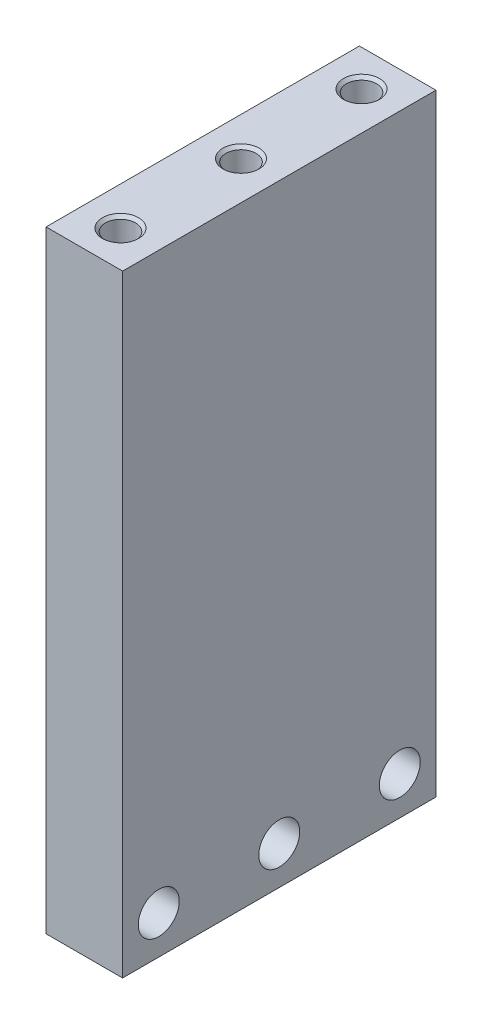
from build123d import *

# Parameters (mm, degrees)
SKETCH1_W           = 6.35
SKETCH1_H           = 50.8
BOSS_EXTRUDE1_DEPTH = 26
SKETCH4_R           = 1.7
CUT_EXTRUDE3_DEPTH  = 6.35
SKETCH14_R          = 1.25
CUT_EXTRUDE13_DEPTH = 5
CHAMFER3_SIZE       = 0.25


with BuildPart() as part:
    # Sketch1 → Boss-Extrude1 (new body)
    with BuildSketch(Plane.XY):
        with Locations((3.175, 25.4)):
            Rectangle(SKETCH1_W, SKETCH1_H)
    extrude(amount=BOSS_EXTRUDE1_DEPTH)

    # Sketch4 → Cut-Extrude3 (cut)
    with BuildSketch(Plane(origin=(6.35, 0, 0), x_dir=(0, 0, -1), z_dir=(1, 0, 0))):
        with Locations((-3, 3.175)):
            Circle(SKETCH4_R)
        with Locations((-23, 3.175)):
            Circle(SKETCH4_R)
        with Locations((-13, 3.175)):
            Circle(SKETCH4_R)
    extrude(amount=-CUT_EXTRUDE3_DEPTH, mode=Mode.SUBTRACT)

    # Sketch14 → Cut-Extrude13 (cut)
    with BuildSketch(Plane(origin=(0, 50.8, 0), x_dir=(1, 0, 0), z_dir=(0, 1, 0))):
        with Locations((3.175, -23)):
            Circle(SKETCH14_R)
        with Locations((3.175, -13)):
            Circle(SKETCH14_R)
        with Locations((3.175, -3)):
            Circle(SKETCH14_R)
    extrude(amount=-CUT_EXTRUDE13_DEPTH, mode=Mode.SUBTRACT)

    # Chamfer3
    chamfer3_edges = [part.edges().sort_by_distance(p)[0] for p in [
        (1.925, 50.8, 23),
        (1.925, 50.8, 13),
        (1.925, 50.8, 3),
    ]]
    chamfer(chamfer3_edges, length=CHAMFER3_SIZE)


solid = part.part
